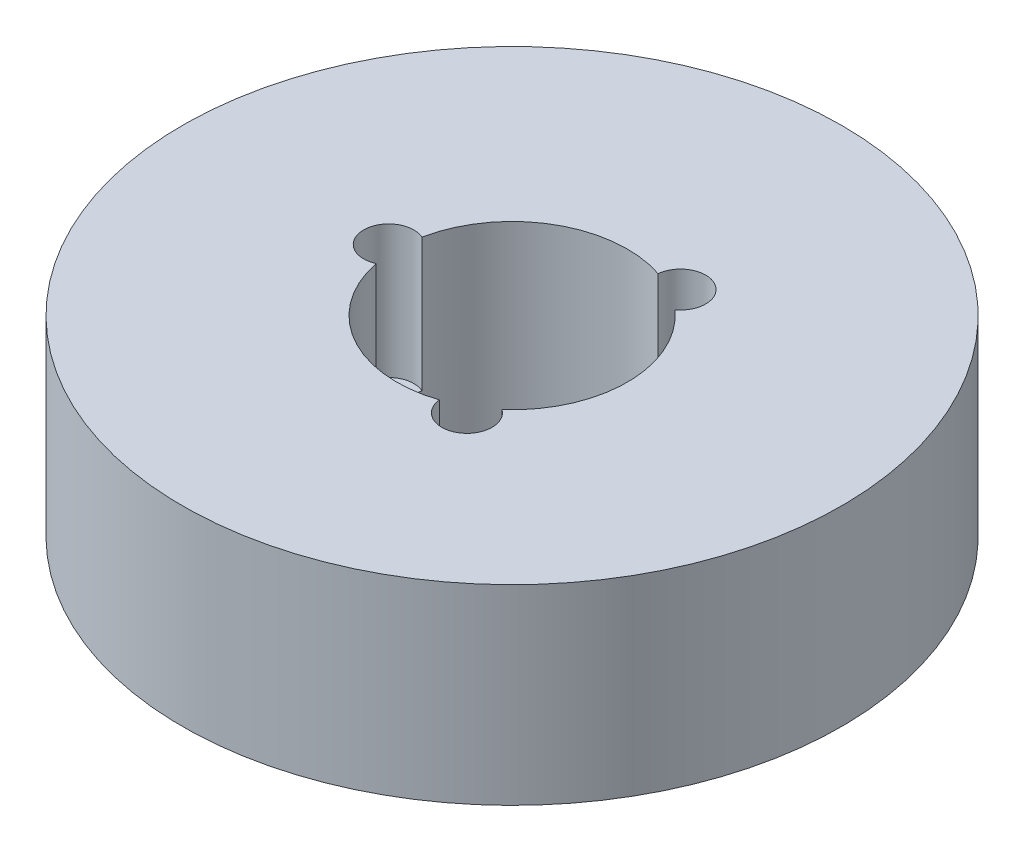
from build123d import *

# Parameters (mm, degrees)
SKETCH1_R           = 50
BOSS_EXTRUDE1_DEPTH = 29
SKETCH2_R           = 17.5
CUT_EXTRUDE1_DEPTH  = 77.426435217
SKETCH3_R           = 3.812041362
CUT_EXTRUDE2_DEPTH  = 20.188504131
CIRPATTERN1_COUNT   = 3


with BuildPart() as part:
    # Sketch1 → Boss-Extrude1 (new body)
    with BuildSketch(Plane(origin=(0, 0, 0), x_dir=(1, 0, 0), z_dir=(0, 1, 0))):
        Circle(SKETCH1_R)
    extrude(amount=BOSS_EXTRUDE1_DEPTH)

    # Sketch2 → Cut-Extrude1 (cut, through all)
    with BuildSketch(Plane(origin=(0, 0, 0), x_dir=(1, 0, 0), z_dir=(0, 1, 0))):
        Circle(SKETCH2_R)
    extrude(amount=CUT_EXTRUDE1_DEPTH, mode=Mode.SUBTRACT)

    # Sketch3 → Cut-Extrude2 (cut)
    with BuildSketch(Plane(origin=(0, 29, 0), x_dir=(1, 0, 0), z_dir=(0, 1, 0))):
        with Locations((-18.711384726, 0)):
            Circle(SKETCH3_R)
    cut_extrude2 = extrude(amount=-CUT_EXTRUDE2_DEPTH, mode=Mode.SUBTRACT)

    # CirPattern1: Cut-Extrude2 ×3 about axis
    cirpattern1_axis = Axis((0, 0, 0), (0, 1, 0))
    for i in range(1, CIRPATTERN1_COUNT):
        add(cut_extrude2.rotate(cirpattern1_axis, i * 360 / CIRPATTERN1_COUNT), mode=Mode.SUBTRACT)


solid = part.part
